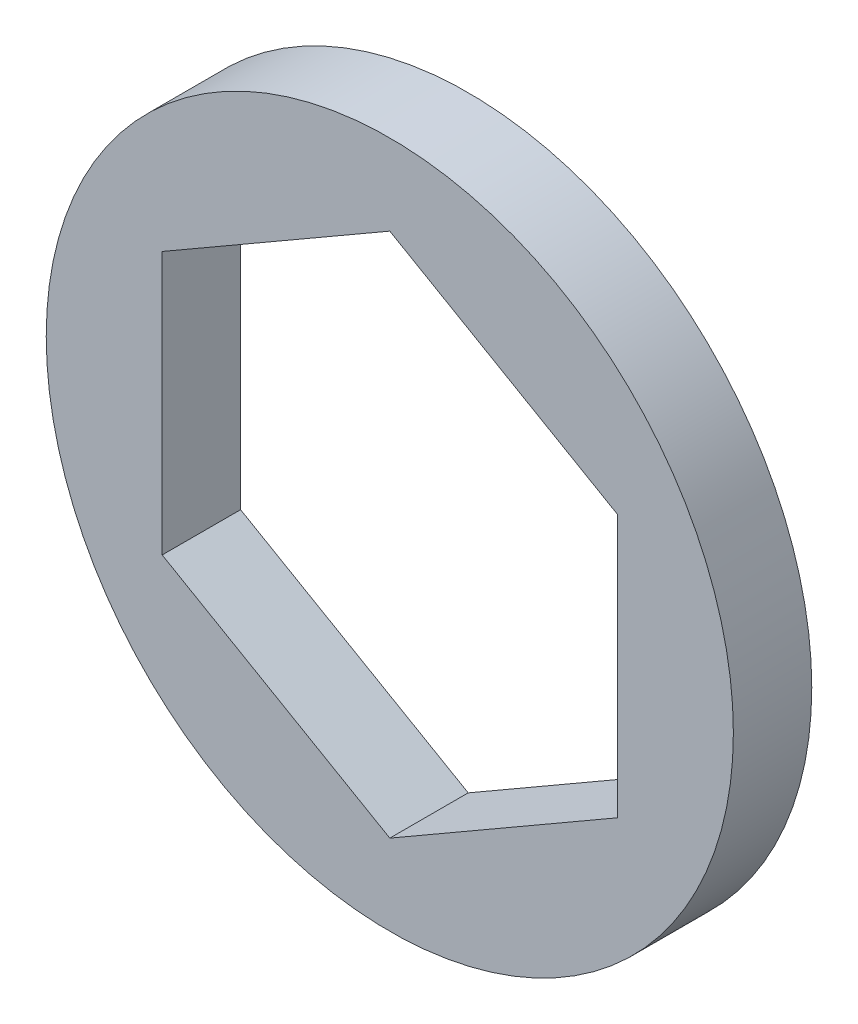
from build123d import *

# Parameters (mm, degrees)
SKETCH1_R           = 10.16
BOSS_EXTRUDE1_DEPTH = 2.318499808


with BuildPart() as part:
    # Sketch1 → Boss-Extrude1 (new body)
    with BuildSketch(Plane.XY):
        Circle(SKETCH1_R)
        Polygon((6.731, 3.886144662), (0, 7.772289324), (-6.731, 3.886144662), (-6.731, -3.886144662), (0, -7.772289324), (6.731, -3.886144662), align=None, mode=Mode.SUBTRACT)
    extrude(amount=BOSS_EXTRUDE1_DEPTH)


solid = part.part
